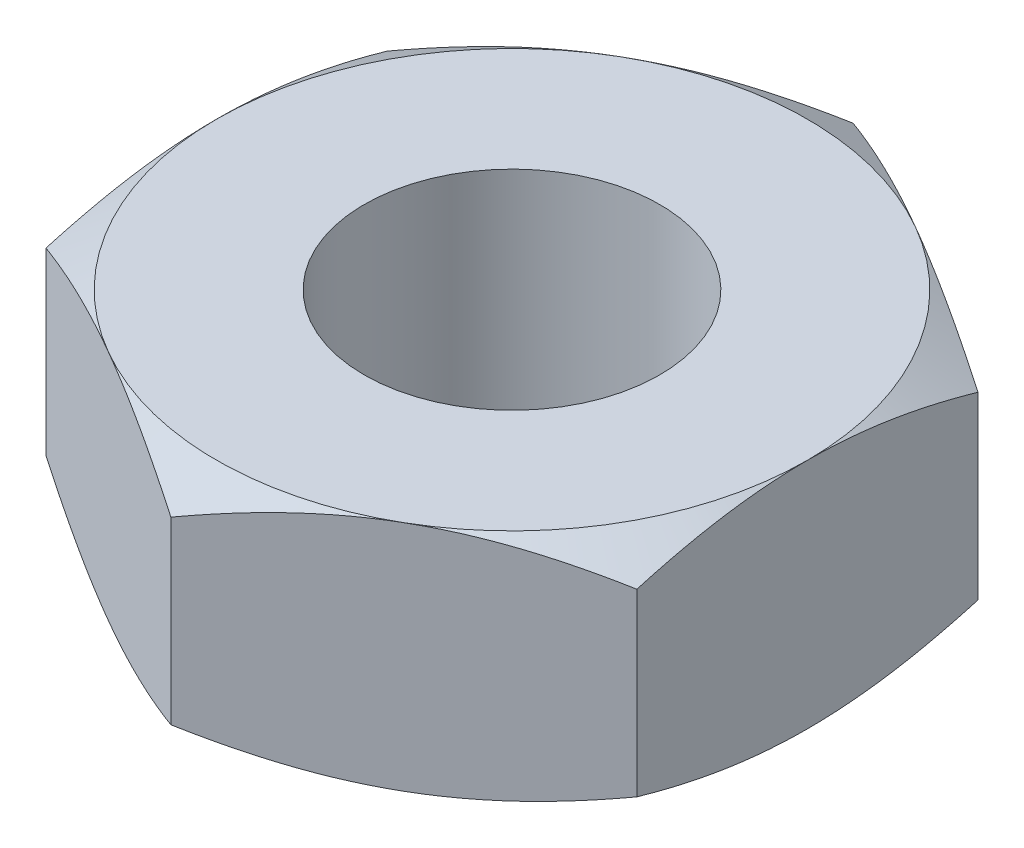
from build123d import *

# Parameters (mm, degrees)
BOSS_EXTRUDE1_DEPTH     = 5
SKETCH2_R               = 6.35
CUT_EXTRUDE1_DEPTH      = 22.82529114
SKETCH3_OUTSIDE_W       = 114.482
SKETCH3_OUTSIDE_H       = 118.412
SKETCH3_OUTSIDE_R       = 12.7
CUT_EXTRUDE2_DEPTH      = 22.82529114
CUT_EXTRUDE2_DRAFT      = -60
MIRROR1_COPY_1_SKETCH_W = 114.482
MIRROR1_COPY_1_SKETCH_H = 118.412
MIRROR1_COPY_1_SKETCH_R = 12.7
MIRROR1_COPY_1_DEPTH    = 22.82529114
MIRROR1_COPY_1_DRAFT    = -60


with BuildPart() as part:
    # Sketch1 → Boss-Extrude1 (new, symmetric)
    with BuildSketch(Plane(origin=(0, 0, 0), x_dir=(1, 0, 0), z_dir=(0, 1, 0))):
        Polygon((12.7, 7.332348419), (0, 14.664696837), (-12.7, 7.332348419), (-12.7, -7.332348419), (0, -14.664696837), (12.7, -7.332348419), align=None)
    extrude(amount=BOSS_EXTRUDE1_DEPTH, both=True)

    # Sketch2 → Cut-Extrude1 (cut, through all)
    with BuildSketch(Plane(origin=(0, 5, 0), x_dir=(1, 0, 0), z_dir=(0, 1, 0))):
        Circle(SKETCH2_R)
    extrude(amount=-CUT_EXTRUDE1_DEPTH, mode=Mode.SUBTRACT)


with BuildPart() as cut_extrude2_tool:
    # Sketch3 outside → Cut-Extrude2 (with draft: the straight prism first)
    with BuildSketch(Plane(origin=(0, 5, 0), x_dir=(1, 0, 0), z_dir=(0, 1, 0))):
        Rectangle(SKETCH3_OUTSIDE_W, SKETCH3_OUTSIDE_H)
        Circle(SKETCH3_OUTSIDE_R, mode=Mode.SUBTRACT)
    extrude(amount=-CUT_EXTRUDE2_DEPTH)
    # Cut-Extrude2: the draft: its side faces are tilted about the plane it starts from
    cut_extrude2_sides = [cut_extrude2_tool.faces().sort_by_distance(p)[0] for p in [
        (0, -6.41264557, 59.206),
        (57.241, -6.41264557, 0),
        (0, -6.41264557, -59.206),
        (-57.241, -6.41264557, 0),
        (-12.7, -6.41264557, 0),
    ]]
    draft(cut_extrude2_sides, Plane(origin=(0, 5, 0), x_dir=(1, 0, 0), z_dir=(0, 1, 0)), CUT_EXTRUDE2_DRAFT)


with BuildPart() as part_1:
    add(part.part)

    # Cut-Extrude2: cut by cut_extrude2_tool
    add(cut_extrude2_tool.part, mode=Mode.SUBTRACT)


with BuildPart() as mirror1_copy_1_tool:
    # Mirror1 copy 1 sketch → Mirror1 copy 1 (with draft: the straight prism first)
    with BuildSketch(Plane.XZ.offset(5)):
        Rectangle(MIRROR1_COPY_1_SKETCH_W, MIRROR1_COPY_1_SKETCH_H)
        Circle(MIRROR1_COPY_1_SKETCH_R, mode=Mode.SUBTRACT)
    extrude(amount=-MIRROR1_COPY_1_DEPTH)
    # Mirror1 copy 1: the draft: its side faces are tilted about the plane it starts from
    mirror1_copy_1_sides = [mirror1_copy_1_tool.faces().sort_by_distance(p)[0] for p in [
        (0, 6.41264557, 59.206),
        (57.241, 6.41264557, 0),
        (0, 6.41264557, -59.206),
        (-57.241, 6.41264557, 0),
        (-12.7, 6.41264557, 0),
    ]]
    draft(mirror1_copy_1_sides, Plane.XZ.offset(5), MIRROR1_COPY_1_DRAFT)


with BuildPart() as part_2:
    add(part_1.part)

    # Mirror1 copy 1: cut by mirror1_copy_1_tool
    add(mirror1_copy_1_tool.part, mode=Mode.SUBTRACT)


solid = part_2.part
